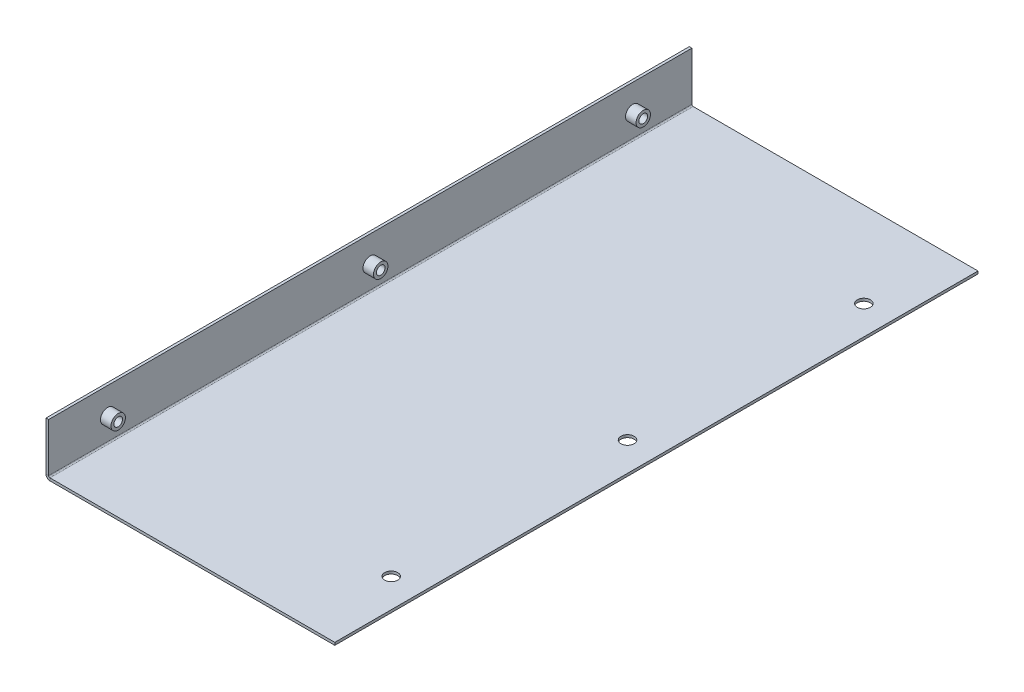
from build123d import *

# Parameters (mm, degrees)
SM_BASE_FLANGE_1_DEPTH = 122.5
CUT_EXTRUDE_1_REACH    = 167.732
SKETCH_4_R             = 2.5
SKETCH_7_R             = 2.75
EXTRUDE_1_DEPTH        = 5
HOLE_WIZARD_M4_1_D     = 3.3
HOLE_WIZARD_M4_1_DEPTH = 10.1
HOLE_WIZARD_M4_1_TIP   = 0.991420021


# Sheet-metal steps are written as plain solids
with BuildPart() as part:
    # Sketch 1 → 基体-法兰1 (new, symmetric)
    with BuildSketch(Plane.XY):
        with BuildLine():
            Line((0, 20), (0, 1.5))
            ThreePointArc((0, 1.5), (0.439339828, 0.439339828), (1.5, 0))
            Line((1.5, 0), (110, 0))
            Line((110, 0), (110, 1))
            Line((110, 1), (1.5, 1))
            ThreePointArc((1.5, 1), (1.146446609, 1.146446609), (1, 1.5))
            Line((1, 1.5), (1, 20))
            Line((1, 20), (0, 20))
        make_face()
    extrude(amount=SM_BASE_FLANGE_1_DEPTH, both=True)

    # 草图4 → 切除-拉伸1 (cut, up to next)
    with BuildSketch(Plane(origin=(0, 1, 0), x_dir=(1, 0, 0), z_dir=(0, 1, 0)), mode=Mode.PRIVATE) as cut_extrude_1_sk1:
        with Locations(Location((99, 0, 0), (0, 0, 270))):
            Circle(SKETCH_4_R)
    cut_extrude_1_tool1 = extrude(cut_extrude_1_sk1.sketch, amount=-CUT_EXTRUDE_1_REACH, mode=Mode.PRIVATE) & part.part
    # 草图4 → 切除-拉伸1 (cut, up to next)
    with BuildSketch(Plane(origin=(0, 1, 0), x_dir=(1, 0, 0), z_dir=(0, 1, 0)), mode=Mode.PRIVATE) as cut_extrude_1_sk2:
        with Locations(Location((99, 90, 0), (0, 0, 270))):
            Circle(SKETCH_4_R)
    cut_extrude_1_tool2 = extrude(cut_extrude_1_sk2.sketch, amount=-CUT_EXTRUDE_1_REACH, mode=Mode.PRIVATE) & part.part
    # 草图4 → 切除-拉伸1 (cut, up to next)
    with BuildSketch(Plane(origin=(0, 1, 0), x_dir=(1, 0, 0), z_dir=(0, 1, 0)), mode=Mode.PRIVATE) as cut_extrude_1_sk3:
        with Locations(Location((99, -90, 0), (0, 0, 270))):
            Circle(SKETCH_4_R)
    cut_extrude_1_tool3 = extrude(cut_extrude_1_sk3.sketch, amount=-CUT_EXTRUDE_1_REACH, mode=Mode.PRIVATE) & part.part
    add(cut_extrude_1_tool1.solids().sort_by_distance((99, 1, 0))[0], mode=Mode.SUBTRACT)
    add(cut_extrude_1_tool2.solids().sort_by_distance((99, 1, -90))[0], mode=Mode.SUBTRACT)
    add(cut_extrude_1_tool3.solids().sort_by_distance((99, 1, 90))[0], mode=Mode.SUBTRACT)

    # 草图7 → 凸台-拉伸1 (add)
    with BuildSketch(Plane.ZY):
        with Locations(Location((0, 10, 0), (0, 0, 270))):
            Circle(SKETCH_7_R)
        with Locations(Location((-100, 10, 0), (0, 0, 270))):
            Circle(SKETCH_7_R)
        with Locations(Location((100, 10, 0), (0, 0, 270))):
            Circle(SKETCH_7_R)
    extrude(amount=-EXTRUDE_1_DEPTH)

    # M4 螺纹孔1
    with Locations(Plane.ZY):
        with Locations((100, 10), (0, 10), (-100, 10)):
            Hole(HOLE_WIZARD_M4_1_D / 2, depth=HOLE_WIZARD_M4_1_DEPTH)
            with Locations((0, 0, -(HOLE_WIZARD_M4_1_DEPTH + HOLE_WIZARD_M4_1_TIP / 2))):  # 118° drill point
                Cone(0, HOLE_WIZARD_M4_1_D / 2, HOLE_WIZARD_M4_1_TIP, mode=Mode.SUBTRACT)


solid = part.part
